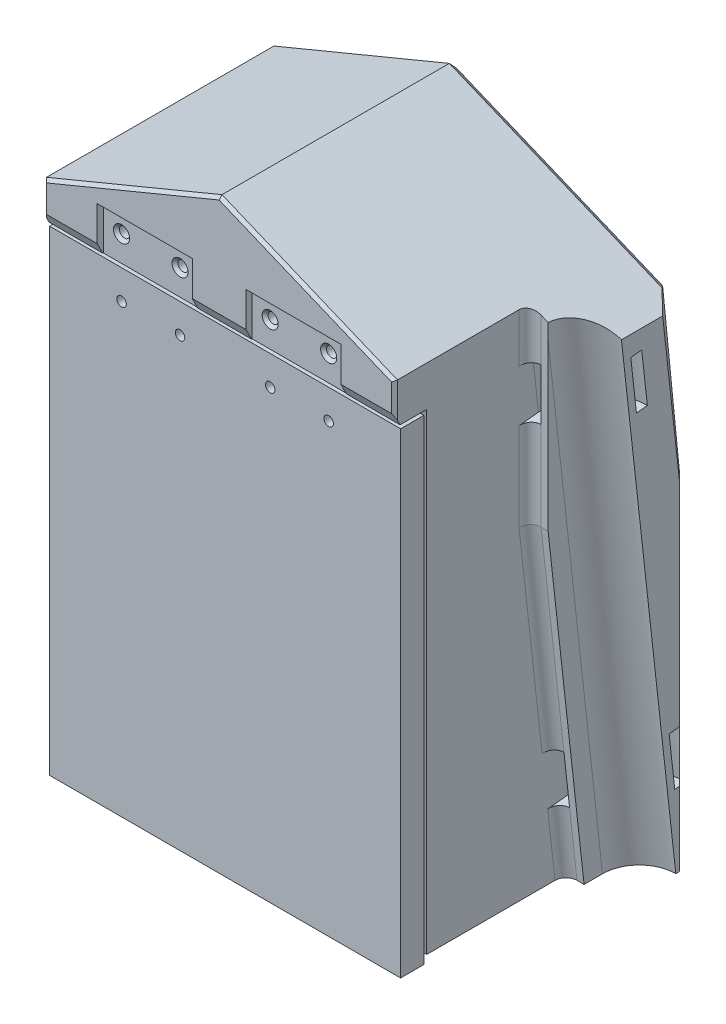
from build123d import *

# Parameters (mm, degrees)
SKETCH1_W               = 90
SKETCH1_H               = 123.117749006
MAIN_EXTRUDE_DEPTH      = 60
REAR_EXTRUDE_DEPTH      = 5
BOSS_EXTRUDE3_REACH     = 179.494
CUT_EXTRUDE9_DEPTH      = 203.415334916
CUT_EXTRUDE10_DEPTH     = 14
LPATTERN1_COUNT         = 2
LPATTERN1_PITCH         = 95
FILLET2_R               = 3
SKETCH9_R               = 3
INNER_DRAIN_HOLES_DEPTH = 15
CUT_EXTRUDE2_DEPTH      = 8
SKETCH5_W               = 26
SKETCH5_H               = 27
CUT_EXTRUDE3_DEPTH      = 1.65
SKETCH15_R              = 1.4
CUT_EXTRUDE7_DEPTH      = 40
SKETCH12_W              = 96.002
SKETCH12_H              = 130.117749006
BOSS_EXTRUDE5_DEPTH     = 6.35
SKETCH13_R              = 1.3
CUT_EXTRUDE8_DEPTH      = 130.250127042
CHAMFER4_SIZE           = 3
CHAMFER4_SIZE2          = 1.5
CHAMFER7_SIZE           = 0.8
CAVITY_FILLET_R         = 5
SKETCH21_R              = 1.3
BOSS_EXTRUDE10_DEPTH    = 3
SKETCH22_R              = 2
CUT_EXTRUDE11_DEPTH     = 128.641579591
CHAMFER6_SIZE           = 0.8
CHAMFER2_SIZE           = 2
CHAMFER9_SIZE           = 0.8


with BuildPart() as part:
    # Sketch1 → main-extrude (new body)
    with BuildSketch(Plane.XY):
        Polygon((-48, 73.558874503), (-48, -66.558874503), (48, -66.558874503), (48, 73.558874503), (0, 93.441125497), align=None)
        Rectangle(SKETCH1_W, SKETCH1_H, mode=Mode.SUBTRACT)
    extrude(amount=MAIN_EXTRUDE_DEPTH)

    # Sketch2 → rear-extrude (add)
    with BuildSketch(Plane.XY):
        Polygon((48, -66.558874503), (48, 73.558874503), (0, 93.441125497), (-48, 73.558874503), (-48, -66.558874503), align=None)
    extrude(amount=-REAR_EXTRUDE_DEPTH)

    # Boss-Extrude3: up to this plane
    boss_extrude3_end = Plane(origin=(48, 73.558874503, 60), z_dir=(-0.38268343236508395, -0.9238795325112892, 0))
    # Sketch6 → Boss-Extrude3 (add, up to the surface)
    with BuildSketch(Plane.XZ.offset(66.558874503), mode=Mode.PRIVATE) as boss_extrude3_sk1:
        Polygon((48, 22.9375), (52, 22.9375), (55, 22.9375), (62.9375, 22.9375), (62.9375, 15), (62.9375, -5), (48, -5), align=None)
    boss_extrude3_tool1 = split(extrude(boss_extrude3_sk1.sketch, amount=-BOSS_EXTRUDE3_REACH, mode=Mode.PRIVATE), bisect_by=boss_extrude3_end, keep=Keep.BOTH, mode=Mode.PRIVATE)
    add(boss_extrude3_tool1.solids().sort_by_distance((55.46875, -66.558875, 8.96875))[0])

    # Sketch20 → Cut-Extrude9 (cut, through all)
    with BuildSketch(Plane(origin=(62.9375, -67.662811816, 7.938879334), x_dir=(1, 0, 0), z_dir=(0, 0.9938879333627552, 0.11039373132524995))):
        with BuildLine():
            Line((10, 0), (10, -24.570160676))
            Line((10, -24.570160676), (-14.9375, -24.570160676))
            Line((-14.9375, -24.570160676), (-14.9375, -5))
            Line((-14.9375, -5), (-10, -5))
            Line((-10, -5), (-10, 0))
            ThreePointArc((-10, 0), (0, 10), (10, 0))
        make_face()
        Polygon((21.213203436, 0), (-21.213203436, 42.426406871), (21.213203436, 42.426406871), align=None)
    extrude(amount=CUT_EXTRUDE9_DEPTH, mode=Mode.SUBTRACT)

    # Sketch7 → Cut-Extrude10 (cut)
    with BuildSketch(Plane(origin=(62.9375, -47.785053149, 10.14675396), x_dir=(1, 0, 0), z_dir=(0, 0.9938879333627552, 0.11039373132524995))):
        with BuildLine():
            Line((-14.9375, -15), (-11.9375, -15))
            Line((-11.9375, -15), (-11.9375, -5))
            Line((-11.9375, -5), (-11.9375, 0))
            ThreePointArc((-11.9375, 0), (-8.4410872, 8.4410872), (0, 11.9375))
            Line((0, 11.9375), (10, 11.9375))
            Line((10, 11.9375), (10, 14.9375))
            Line((10, 14.9375), (0, 14.9375))
            ThreePointArc((0, 14.9375), (-10.562407544, 10.562407544), (-14.9375, 0))
            Line((-14.9375, 0), (-14.9375, -15))
        make_face()
    cut_extrude10 = extrude(amount=CUT_EXTRUDE10_DEPTH, mode=Mode.SUBTRACT)

    # LPattern1: Cut-Extrude10 ×2
    with Locations(*[Vector(0, 0.9938879333627553, 0.11039373132525) * (i * LPATTERN1_PITCH) for i in range(1, LPATTERN1_COUNT)]):
        add(cut_extrude10, mode=Mode.SUBTRACT)

    # Fillet2
    fillet2_edges = [part.edges().sort_by_distance(p)[0] for p in [
        (48, 67.011716003, 22.9375),
        (48, 34.228797461, 22.9375),
        (48, -57.447948154, 14.104219216),
        (48, -6.171729083, 19.799602933),
    ]]
    fillet(fillet2_edges, radius=FILLET2_R)

    # Sketch9 → inner-drain-holes (cut)
    with BuildSketch(Plane.XZ.offset(66.558874503)):
        with Locations(Location((-30, 3, 0), (0, 0, 270))):
            Circle(SKETCH9_R)
        with Locations(Location((0, 3, 0), (0, 0, 270))):
            Circle(SKETCH9_R)
        with Locations(Location((30, 3, 0), (0, 0, 270))):
            Circle(SKETCH9_R)
    extrude(amount=-INNER_DRAIN_HOLES_DEPTH, mode=Mode.SUBTRACT)

    # Sketch4 → Cut-Extrude2 (cut)
    with BuildSketch(Plane.XY.offset(60)):
        Polygon((-48, 61.558874503), (-48, -66.558874503), (48, -66.558874503), (48, 61.558874503), (48, 62.558874503), (-48, 62.558874503), align=None)
    extrude(amount=-CUT_EXTRUDE2_DEPTH, mode=Mode.SUBTRACT)

    # Sketch5 → Cut-Extrude3 (cut)
    with BuildSketch(Plane.XY.offset(60)):
        with Locations((-20.333333333, 61.558874503)):
            Rectangle(SKETCH5_W, SKETCH5_H)
        with Locations((20.333333333, 61.558874503)):
            Rectangle(SKETCH5_W, SKETCH5_H)
    extrude(amount=-CUT_EXTRUDE3_DEPTH, mode=Mode.SUBTRACT)

    # Sketch15 → Cut-Extrude7 (cut)
    with BuildSketch(Plane.XY.offset(58.35)):
        with Locations((-28.333333333, 69.558874503)):
            Circle(SKETCH15_R)
        with Locations((-12.333333333, 69.558874503)):
            Circle(SKETCH15_R)
        with Locations(Location((28.333333333, 69.558874503, 0), (0, 0, 180))):
            Circle(SKETCH15_R)
        with Locations(Location((12.333333333, 69.558874503, 0), (0, 0, 180))):
            Circle(SKETCH15_R)
    extrude(amount=-CUT_EXTRUDE7_DEPTH, mode=Mode.SUBTRACT)

    # Chamfer4
    chamfer4_edges = [part.edges().sort_by_distance(p)[0] for p in [
        (40.666666667, 62.558874503, 60),
        (0, 62.558874503, 60),
        (-40.666666667, 62.558874503, 60),
    ]]
    chamfer4_side = [part.faces().sort_by_distance(p)[0] for p in [
        (0, 76.208462952, 60),
    ]]
    chamfer(chamfer4_edges, length=CHAMFER4_SIZE, length2=CHAMFER4_SIZE2, reference=chamfer4_side[0])

    # Chamfer7
    chamfer7_edges = [part.edges().sort_by_distance(p)[0] for p in [
        (-29.733333333, 69.558874503, 58.35),
        (13.733333333, 69.558874503, 58.35),
        (29.733333333, 69.558874503, 58.35),
        (-13.733333333, 69.558874503, 58.35),
    ]]
    chamfer(chamfer7_edges, length=CHAMFER7_SIZE)

    # cavity-fillet
    cavity_fillet_edges = [part.edges().sort_by_distance(p)[0] for p in [
        (-45, -61.558874503, 26),
        (45, -61.558874503, 26),
        (-45, 61.558874503, 26),
        (45, 61.558874503, 26),
    ]]
    fillet(cavity_fillet_edges, radius=CAVITY_FILLET_R)

    # Sketch22 → Cut-Extrude11 (cut, through all)
    with BuildSketch(Plane.XY):
        with Locations((-38.5, 55.058874503)):
            Circle(SKETCH22_R)
        with Locations((38.5, 55.058874503)):
            Circle(SKETCH22_R)
        with Locations((-38.5, -55.058874503)):
            Circle(SKETCH22_R)
        with Locations((38.5, -55.058874503)):
            Circle(SKETCH22_R)
    extrude(amount=-CUT_EXTRUDE11_DEPTH, mode=Mode.SUBTRACT)

    # Chamfer6
    chamfer6_edges = [part.edges().sort_by_distance(p)[0] for p in [
        (48, -2, 52),
        (0, -66.558874503, 52),
        (-48, -2, 52),
        (0, -61.558874503, 52),
        (45, 0, 52),
        (-45, 0, 52),
        (0, 61.558874503, 52),
        (43.535533906, -60.094408409, 52),
        (-43.535533906, -60.094408409, 52),
        (43.535533906, 60.094408409, 52),
        (-43.535533906, 60.094408409, 52),
    ]]
    chamfer(chamfer6_edges, length=CHAMFER6_SIZE)

    # Chamfer2
    # the kernel refuses this chamfer: 2 mm, written as the material it takes off along each edge
    with BuildSketch(Plane(origin=(62.9375, -71.702240479, -5), x_dir=(0, 0, 1), z_dir=(0, 1, 0))) as chamfer2_piece_1:
        Polygon((CHAMFER2_SIZE, 0), (0, -CHAMFER2_SIZE), (0, 0), align=None)
    extrude(amount=105.425477205, mode=Mode.SUBTRACT)
    with BuildSketch(Plane(origin=(-53.143365976, -66.558874503, -5), x_dir=(0, 0, 1), z_dir=(1, 0, 0))) as chamfer2_piece_2:
        Polygon((CHAMFER2_SIZE, 0), (0, -CHAMFER2_SIZE), (0, 0), align=None)
    extrude(amount=121.224231952, mode=Mode.SUBTRACT)
    with BuildSketch(Plane(origin=(-48, 78.702240479, -5), x_dir=(1, 0, 0), z_dir=(0, -1, 0))) as chamfer2_piece_3:
        Polygon((CHAMFER2_SIZE, 0), (0, CHAMFER2_SIZE), (0, 0), align=None)
    extrude(amount=150.404480958, mode=Mode.SUBTRACT)
    with BuildSketch(Plane(origin=(-4.751850553, 95.409406443, -5), x_dir=(0, 0, 1), z_dir=(0.9238795325112892, -0.3826834323650842, 0))) as chamfer2_piece_4:
        Polygon((CHAMFER2_SIZE, 0), (0, CHAMFER2_SIZE), (0, 0), align=None)
    extrude(amount=70.976385497, mode=Mode.SUBTRACT)
    with BuildSketch(Plane(origin=(4.751850553, 95.409406443, -5), x_dir=(0, 0, 1), z_dir=(-0.9238795325112891, -0.3826834323650843, 0))) as chamfer2_piece_5:
        Polygon((CHAMFER2_SIZE, 0), (0, -CHAMFER2_SIZE), (0, 0), align=None)
    extrude(amount=62.241557566, mode=Mode.SUBTRACT)

    # Chamfer9
    chamfer9_edges = [part.edges().sort_by_distance(p)[0] for p in [
        (24, 83.5, 60),
        (48, 69.558874503, 60),
        (-24, 83.5, 60),
        (-48, 69.558874503, 60),
    ]]
    chamfer(chamfer9_edges, length=CHAMFER9_SIZE)


with BuildPart() as body_2:
    # Sketch12 → Boss-Extrude5 (new body)
    with BuildSketch(Plane.XY.offset(52)):
        with Locations((0, -3.5)):
            Rectangle(SKETCH12_W, SKETCH12_H)
    extrude(amount=BOSS_EXTRUDE5_DEPTH)

    # Sketch13 → Cut-Extrude8 (cut, through all)
    with BuildSketch(Plane.XY.offset(58.35)):
        with Locations((-28.333333333, 53.558874503)):
            Circle(SKETCH13_R)
        with Locations((-12.333333333, 53.558874503)):
            Circle(SKETCH13_R)
        with Locations((12.333333333, 53.558874503)):
            Circle(SKETCH13_R)
        with Locations((28.333333333, 53.558874503)):
            Circle(SKETCH13_R)
    extrude(amount=-CUT_EXTRUDE8_DEPTH, mode=Mode.SUBTRACT)


with BuildPart() as body_3:
    # Sketch21 → Boss-Extrude10 (new body)
    with BuildSketch(Plane.XY):
        with BuildLine():
            Line((30, -61.058874503), (40, -61.058874503))
            ThreePointArc((40, -61.058874503), (43.181980515, -59.740855018), (44.5, -56.558874503))
            Line((44.5, -56.558874503), (44.5, 56.558874503))
            ThreePointArc((44.5, 56.558874503), (43.181980515, 59.740855018), (40, 61.058874503))
            Line((40, 61.058874503), (-40, 61.058874503))
            ThreePointArc((-40, 61.058874503), (-43.181980515, 59.740855018), (-44.5, 56.558874503))
            Line((-44.5, 56.558874503), (-44.5, -56.558874503))
            ThreePointArc((-44.5, -56.558874503), (-43.181980515, -59.740855018), (-40, -61.058874503))
            Line((-40, -61.058874503), (-30, -61.058874503))
            Line((-30, -61.058874503), (0, -61.058874503))
            Line((0, -61.058874503), (30, -61.058874503))
        make_face()
        with Locations((-38.5, 55.058874503)):
            Circle(SKETCH21_R, mode=Mode.SUBTRACT)
        with Locations((38.5, 55.058874503)):
            Circle(SKETCH21_R, mode=Mode.SUBTRACT)
        with Locations((-38.5, -55.058874503)):
            Circle(SKETCH21_R, mode=Mode.SUBTRACT)
        with Locations((38.5, -55.058874503)):
            Circle(SKETCH21_R, mode=Mode.SUBTRACT)
    extrude(amount=BOSS_EXTRUDE10_DEPTH)


solid = Compound([part.part, body_2.part, body_3.part])
